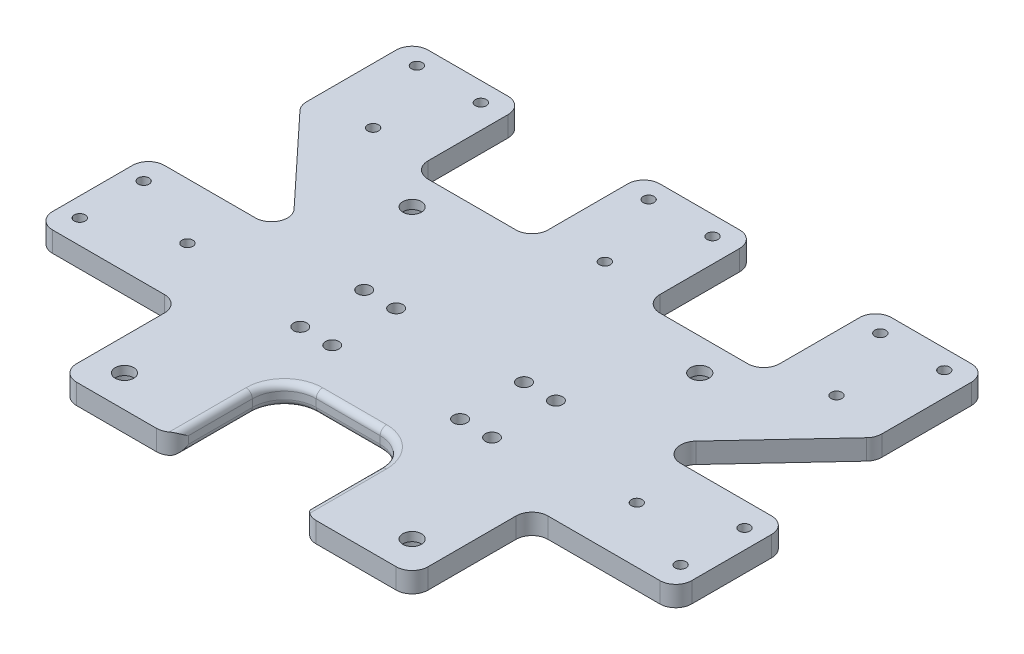
from build123d import *

# Parameters (mm, degrees)
BOSS_EXTRUDE1_DEPTH                     = 6.35
SKETCH4_W                               = 40
SKETCH4_H                               = 35
CUT_EXTRUDE1_DEPTH                      = 135.686014493
FILLET1_R                               = 5
CBORE_FOR_M5_HEX_HEAD_BOLT1_D           = 5.8
CBORE_FOR_M5_HEX_HEAD_BOLT1_CBORE_D     = 12.24
CBORE_FOR_M5_HEX_HEAD_BOLT1_CBORE_DEPTH = 3.58
FILLET2_R                               = 10
FILLET3_R                               = 2
CBORE_FOR_M3_SHCS1_D                    = 3.4
CBORE_FOR_M3_SHCS1_CBORE_D              = 6.5
CBORE_FOR_M3_SHCS1_CBORE_DEPTH          = 3
M5X0_8_TAPPED_HOLE1_D                   = 4.2


with BuildPart() as part:
    # Sketch1 → Boss-Extrude1 (new body)
    with BuildSketch(Plane(origin=(0, 0, 0), x_dir=(1, 0, 0), z_dir=(0, 1, 0))):
        Polygon((55, -55), (-55, -55), (-55, -17.5), (-100, -17.5), (-100, 17.5), (-55, 17.5), (-90, 55), (-90, 90), (-55, 90), (-55, 55), (-17.5, 55), (-17.5, 90), (17.5, 90), (17.5, 55), (55, 55), (55, 90), (90, 90), (90, 55), (55, 17.5), (100, 17.5), (100, -17.5), (55, -17.5), align=None)
    extrude(amount=BOSS_EXTRUDE1_DEPTH)

    # Sketch4 → Cut-Extrude1 (cut, through all)
    with BuildSketch(Plane(origin=(0, 6.35, 0), x_dir=(1, 0, 0), z_dir=(0, 1, 0))):
        with Locations((0, -37.5)):
            Rectangle(SKETCH4_W, SKETCH4_H)
    extrude(amount=-CUT_EXTRUDE1_DEPTH, mode=Mode.SUBTRACT)

    # Fillet1
    fillet1_edges = [part.edges().sort_by_distance(p)[0] for p in [
        (-90, 3.175, -55),
        (-90, 3.175, -90),
        (-55, 3.175, -90),
        (-55, 3.175, -55),
        (-17.5, 3.175, -55),
        (-17.5, 3.175, -90),
        (17.5, 3.175, -90),
        (17.5, 3.175, -55),
        (55, 3.175, -55),
        (55, 3.175, -90),
        (90, 3.175, -90),
        (90, 3.175, -55),
        (55, 3.175, -17.5),
        (100, 3.175, -17.5),
        (100, 3.175, 17.5),
        (55, 3.175, 17.5),
        (55, 3.175, 55),
        (-55, 3.175, 55),
        (-55, 3.175, 17.5),
        (-100, 3.175, 17.5),
        (-100, 3.175, -17.5),
        (-55, 3.175, -17.5),
        (20, 3.175, 55),
        (-20, 3.175, 55),
    ]]
    fillet(fillet1_edges, radius=FILLET1_R)

    # CBORE for M5 Hex Head Bolt1 (through all)
    with Locations(Plane.XZ):
        with Locations((-45, 45), (-45, -45), (45, -45), (45, 45)):
            CounterBoreHole(CBORE_FOR_M5_HEX_HEAD_BOLT1_D / 2, CBORE_FOR_M5_HEX_HEAD_BOLT1_CBORE_D / 2, CBORE_FOR_M5_HEX_HEAD_BOLT1_CBORE_DEPTH)

    # Fillet2
    fillet2_edges = [part.edges().sort_by_distance(p)[0] for p in [
        (-20, 3.175, 20),
        (20, 3.175, 20),
    ]]
    fillet(fillet2_edges, radius=FILLET2_R)

    # Fillet3
    # the kernel refuses this fillet: 2 mm, written as the material it takes off along each edge
    with BuildSketch(Plane(origin=(20, 6.35, 30), x_dir=(0, -1, 0), z_dir=(0, 0, 1)), Plane(origin=(-20, 6.35, 55), x_dir=(0, -1, 0), z_dir=(0, 0, -1))) as fillet3_piece_1:
        with BuildLine():
            CenterArc((FILLET3_R, FILLET3_R), FILLET3_R, 180, 90)
            Line((0, FILLET3_R), (0, 0))
            Line((0, 0), (FILLET3_R, 0))
        make_face()
    extrude(amount=25, mode=Mode.SUBTRACT)
    with BuildSketch(Plane(origin=(-10, 6.35, 20), x_dir=(0, -1, 0), z_dir=(1, 0, 0))) as fillet3_piece_2:
        with BuildLine():
            CenterArc((FILLET3_R, FILLET3_R), FILLET3_R, 180, 90)
            Line((0, FILLET3_R), (0, 0))
            Line((0, 0), (FILLET3_R, 0))
        make_face()
    extrude(amount=20, mode=Mode.SUBTRACT)
    with BuildSketch(Plane(origin=(-20, 0, 30), x_dir=(-1, 0, 0), z_dir=(0, 0, 1)), Plane(origin=(20, 0, 55), x_dir=(1, 0, 0), z_dir=(0, 0, -1))) as fillet3_piece_3:
        with BuildLine():
            CenterArc((FILLET3_R, -FILLET3_R), FILLET3_R, 90, 90)
            Line((0, -FILLET3_R), (0, 0))
            Line((0, 0), (FILLET3_R, 0))
        make_face()
    extrude(amount=25, mode=Mode.SUBTRACT)
    with BuildSketch(Plane(origin=(10, 0, 20), x_dir=(0, 0, -1), z_dir=(-1, 0, 0))) as fillet3_piece_4:
        with BuildLine():
            CenterArc((FILLET3_R, -FILLET3_R), FILLET3_R, 90, 90)
            Line((0, -FILLET3_R), (0, 0))
            Line((0, 0), (FILLET3_R, 0))
        make_face()
    extrude(amount=20, mode=Mode.SUBTRACT)
    with BuildSketch(Plane(origin=(10, 0, 30), x_dir=(1, 0, 0), z_dir=(0, 0, 1))) as fillet3_piece_5:
        with BuildLine():
            CenterArc((10 + FILLET3_R, FILLET3_R), FILLET3_R, 180, 90)
            Line((10, FILLET3_R), (10, 0))
            Line((10, 0), (10 + FILLET3_R, 0))
        make_face()
    revolve(axis=Axis((10, 0, 30), (0, 1, 0)), revolution_arc=90, mode=Mode.SUBTRACT)
    with BuildSketch(Plane(origin=(-10, 0, 30), x_dir=(0, 0, -1), z_dir=(1, 0, 0))) as fillet3_piece_6:
        with BuildLine():
            CenterArc((10 + FILLET3_R, FILLET3_R), FILLET3_R, 180, 90)
            Line((10, FILLET3_R), (10, 0))
            Line((10, 0), (10 + FILLET3_R, 0))
        make_face()
    revolve(axis=Axis((-10, 0, 30), (0, 1, 0)), revolution_arc=90, mode=Mode.SUBTRACT)
    with BuildSketch(Plane(origin=(-10, 6.35, 30), x_dir=(0, 0, -1), z_dir=(1, 0, 0))) as fillet3_piece_7:
        with BuildLine():
            CenterArc((10 + FILLET3_R, -FILLET3_R), FILLET3_R, 90, 90)
            Line((10 + FILLET3_R, 0), (10, 0))
            Line((10, 0), (10, -FILLET3_R))
        make_face()
    revolve(axis=Axis((-10, 6.35, 30), (0, 1, 0)), revolution_arc=90, mode=Mode.SUBTRACT)
    with BuildSketch(Plane(origin=(10, 6.35, 30), x_dir=(1, 0, 0), z_dir=(0, 0, 1))) as fillet3_piece_8:
        with BuildLine():
            CenterArc((10 + FILLET3_R, -FILLET3_R), FILLET3_R, 90, 90)
            Line((10 + FILLET3_R, 0), (10, 0))
            Line((10, 0), (10, -FILLET3_R))
        make_face()
    revolve(axis=Axis((10, 6.35, 30), (0, 1, 0)), revolution_arc=90, mode=Mode.SUBTRACT)

    # CBORE for M3 SHCS1 (through all)
    with Locations(Plane(origin=(0, 0, 0), x_dir=(-1, 0, 0), z_dir=(0, -1, 0))):
        with Locations((10, 84), (-10, 84), (0, 60.3), (-94, 10), (-94, -10), (-70.3, 0), (94, -10), (94, 10), (70.3, 0), (-82.5, 84), (-62.5, 84), (-72.5, 60.3), (72.5, 60.3), (82.5, 84), (62.5, 84)):
            CounterBoreHole(CBORE_FOR_M3_SHCS1_D / 2, CBORE_FOR_M3_SHCS1_CBORE_D / 2, CBORE_FOR_M3_SHCS1_CBORE_DEPTH)

    # M5x0.8 Tapped Hole1 (through all)
    with Locations(Plane(origin=(0, 0, 0), x_dir=(-1, 0, 0), z_dir=(0, -1, 0))):
        with Locations((-20, 15), (20, 15), (20, -5), (-20, -5), (-30, 15), (-30, -5), (30, 15), (30, -5)):
            Hole(M5X0_8_TAPPED_HOLE1_D / 2)


solid = part.part
